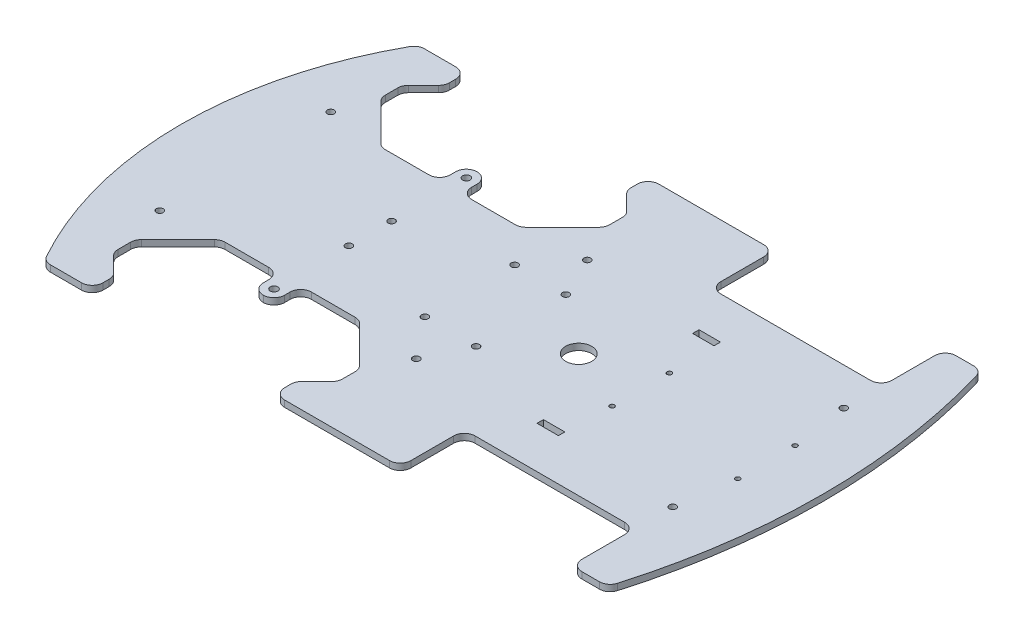
from build123d import *

# Parameters (mm, degrees)
SKETCH1_R           = 1.6
SKETCH1_R_2         = 1.1
SKETCH1_R_3         = 1.75
SKETCH1_R_4         = 6.1
SKETCH1_W           = 10
SKETCH1_H           = 3
BOSS_EXTRUDE1_DEPTH = 3
FILLET1_R           = 5


with BuildPart() as part:
    # Sketch1 → Boss-Extrude1 (new body)
    with BuildSketch(Plane(origin=(0, 0, 0), x_dir=(1, 0, 0), z_dir=(0, 1, 0))):
        with BuildLine():
            Line((40, 87.5), (40, 57.5))
            Line((40, 57.5), (120, 57.5))
            Line((120, 57.5), (120, 87.5))
            Line((120, 87.5), (136.956007081, 87.5))
            ThreePointArc((136.956007081, 87.5), (150, 0), (136.956007081, -87.5))
            Line((136.956007081, -87.5), (120, -87.5))
            Line((120, -87.5), (120, -57.5))
            Line((120, -57.5), (40, -57.5))
            Line((40, -57.5), (40, -87.5))
            Line((40, -87.5), (-19.054445662, -87.5))
            Line((-19.054445662, -87.5), (-19.054445662, -77.5))
            Line((-19.054445662, -77.5), (-9.054445662, -67.5))
            Line((-9.054445662, -67.5), (-9.054445662, -57.465130862))
            Line((-9.054445662, -57.465130862), (-29.037011093, -37.482565431))
            Line((-29.037011093, -37.482565431), (-56.537011093, -37.482565431))
            Line((-56.537011093, -37.482565431), (-56.537011093, -50))
            Line((-56.537011093, -50), (-66.537011093, -50))
            Line((-66.537011093, -50), (-66.537011093, -37.482565431))
            Line((-66.537011093, -37.482565431), (-94.037011093, -37.482565431))
            Line((-94.037011093, -37.482565431), (-114.054445662, -57.5))
            Line((-114.054445662, -57.5), (-114.054445662, -67.5))
            Line((-114.054445662, -67.5), (-104.054445662, -77.5))
            Line((-104.054445662, -77.5), (-104.054445662, -87.5))
            Line((-104.054445662, -87.5), (-126.554445662, -87.5))
            ThreePointArc((-126.554445662, -87.5), (-150, 0), (-126.554445662, 87.5))
            Line((-126.554445662, 87.5), (-104.054445662, 87.5))
            Line((-104.054445662, 87.5), (-104.054445662, 77.5))
            Line((-104.054445662, 77.5), (-114.054445662, 67.5))
            Line((-114.054445662, 67.5), (-114.054445662, 57.5))
            Line((-114.054445662, 57.5), (-94.037011093, 37.482565431))
            Line((-94.037011093, 37.482565431), (-66.537011093, 37.482565431))
            Line((-66.537011093, 37.482565431), (-66.537011093, 50))
            Line((-66.537011093, 50), (-56.537011093, 50))
            Line((-56.537011093, 50), (-56.537011093, 37.482565431))
            Line((-56.537011093, 37.482565431), (-29.037011093, 37.482565431))
            Line((-29.037011093, 37.482565431), (-9.054445662, 57.465130862))
            Line((-9.054445662, 57.465130862), (-9.054445662, 67.5))
            Line((-9.054445662, 67.5), (-19.054445662, 77.5))
            Line((-19.054445662, 77.5), (-19.054445662, 87.5))
            Line((-19.054445662, 87.5), (40, 87.5))
        make_face()
        with Locations(Location((-120, -40, 0), (0, 0, 270))):
            Circle(SKETCH1_R, mode=Mode.SUBTRACT)
        with Locations(Location((0, -40, 0), (0, 0, 270))):
            Circle(SKETCH1_R, mode=Mode.SUBTRACT)
        with Locations(Location((120, -40, 0), (0, 0, 270))):
            Circle(SKETCH1_R, mode=Mode.SUBTRACT)
        with Locations(Location((120, 40, 0), (0, 0, 90))):
            Circle(SKETCH1_R, mode=Mode.SUBTRACT)
        with Locations(Location((0, 40, 0), (0, 0, 90))):
            Circle(SKETCH1_R, mode=Mode.SUBTRACT)
        with Locations(Location((-120, 40, 0), (0, 0, 90))):
            Circle(SKETCH1_R, mode=Mode.SUBTRACT)
        with Locations(Location((-15, 21, 0), (0, 0, 270))):
            Circle(SKETCH1_R, mode=Mode.SUBTRACT)
        with Locations(Location((9, 21, 0), (0, 0, 270))):
            Circle(SKETCH1_R, mode=Mode.SUBTRACT)
        with Locations(Location((9, -21, 0), (0, 0, 90))):
            Circle(SKETCH1_R, mode=Mode.SUBTRACT)
        with Locations(Location((-15, -21, 0), (0, 0, 90))):
            Circle(SKETCH1_R, mode=Mode.SUBTRACT)
        with Locations(Location((123.8, 13.4, 0), (0, 0, 270))):
            Circle(SKETCH1_R_2, mode=Mode.SUBTRACT)
        with Locations(Location((65, 13.4, 0), (0, 0, 270))):
            Circle(SKETCH1_R_2, mode=Mode.SUBTRACT)
        with Locations(Location((65, -13.4, 0), (0, 0, 90))):
            Circle(SKETCH1_R_2, mode=Mode.SUBTRACT)
        with Locations(Location((123.8, -13.4, 0), (0, 0, 90))):
            Circle(SKETCH1_R_2, mode=Mode.SUBTRACT)
        with Locations(Location((-61.537011093, -45, 0), (0, 0, 270))):
            Circle(SKETCH1_R_3, mode=Mode.SUBTRACT)
        with Locations(Location((-61.537011093, 45, 0), (0, 0, 90))):
            Circle(SKETCH1_R_3, mode=Mode.SUBTRACT)
        with Locations(Location((-61.537011093, -10, 0), (0, 0, 270))):
            Circle(SKETCH1_R, mode=Mode.SUBTRACT)
        with Locations(Location((-61.537011093, 10, 0), (0, 0, 90))):
            Circle(SKETCH1_R, mode=Mode.SUBTRACT)
        with Locations(Location((36, 0, 0), (0, 0, 270))):
            Circle(SKETCH1_R_4, mode=Mode.SUBTRACT)
        with Locations((59.4, 36.4)):
            Rectangle(SKETCH1_W, SKETCH1_H, mode=Mode.SUBTRACT)
        with Locations((59.4, -36.4)):
            Rectangle(SKETCH1_W, SKETCH1_H, mode=Mode.SUBTRACT)
    extrude(amount=BOSS_EXTRUDE1_DEPTH)

    # Fillet1
    fillet1_edges = [part.edges().sort_by_distance(p)[0] for p in [
        (-104.054445662, 1.5, -87.5),
        (-104.054445662, 1.5, -77.5),
        (-114.054445662, 1.5, -67.5),
        (-114.054445662, 1.5, -57.5),
        (-9.054445662, 1.5, -57.465130862),
        (-9.054445662, 1.5, -67.5),
        (-19.054445662, 1.5, -77.5),
        (-19.054445662, 1.5, -87.5),
        (40, 1.5, -87.5),
        (40, 1.5, -57.5),
        (120, 1.5, -57.5),
        (120, 1.5, -87.5),
        (136.956007081, 1.5, -87.5),
        (136.956007081, 1.5, 87.5),
        (120, 1.5, 87.5),
        (120, 1.5, 57.5),
        (40, 1.5, 57.5),
        (40, 1.5, 87.5),
        (-19.054445662, 1.5, 87.5),
        (-19.054445662, 1.5, 77.5),
        (-9.054445662, 1.5, 67.5),
        (-9.054445662, 1.5, 57.465130862),
        (-114.054445662, 1.5, 57.5),
        (-114.054445662, 1.5, 67.5),
        (-104.054445662, 1.5, 77.5),
        (-104.054445662, 1.5, 87.5),
        (-126.554445662, 1.5, 87.5),
        (-126.554445662, 1.5, -87.5),
        (-56.537011093, 1.5, -50),
        (-94.037011093, 1.5, -37.482565431),
        (-29.037011093, 1.5, -37.482565431),
        (-66.537011093, 1.5, -50),
        (-29.037011093, 1.5, 37.482565431),
        (-94.037011093, 1.5, 37.482565431),
        (-56.537011093, 1.5, 50),
        (-66.537011093, 1.5, 50),
        (-66.537011093, 1.5, -37.482565431),
        (-56.537011093, 1.5, -37.482565431),
        (-66.537011093, 1.5, 37.482565431),
        (-56.537011093, 1.5, 37.482565431),
    ]]
    fillet(fillet1_edges, radius=FILLET1_R - 0.0001)  # a hair under: the kernel refuses the full size


solid = part.part
